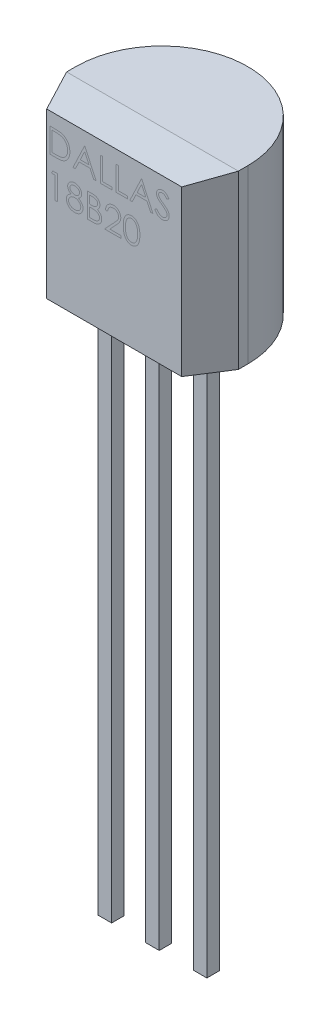
from build123d import *

# Parameters (mm, degrees)
BOSS_EXTRUDE1_DEPTH = 4.58
SKETCH4_W           = 0.36
SKETCH4_H           = 0.33
BOSS_EXTRUDE2_DEPTH = 14.47
SKETCH7_R           = 0.763333333
CUT_EXTRUDE1_DEPTH  = 0.25


with BuildPart() as part:
    # Sketch1 → Boss-Extrude1 (new body)
    with BuildSketch(Plane(origin=(0, 0, 0), x_dir=(1, 0, 0), z_dir=(0, 1, 0))):
        with BuildLine():
            Line((-2.29, 0), (-2.29, -0.25))
            Line((-2.29, -0.25), (2.29, -0.25))
            Line((2.29, -0.25), (2.29, 0))
            ThreePointArc((2.29, 0), (0, 2.29), (-2.29, 0))
        make_face()
    extrude(amount=BOSS_EXTRUDE1_DEPTH)

    # Sketch2 → Loft1 section 0
    with BuildSketch(Plane.XY.offset(0.25)):
        with BuildLine():
            Line((-2.29, 0), (2.29, 0))
            Line((2.29, 0), (2.29, 4.58))
            Line((2.29, 4.58), (-2.29, 4.58))
            Line((-2.29, 4.58), (-2.29, 0))
        make_face()
    # Sketch3 → Loft1 section 1
    with BuildSketch(Plane.XY.offset(1.27)):
        with BuildLine():
            Line((-1.8, 0.1), (1.8, 0.1))
            Line((1.8, 0.1), (1.8, 4.48))
            Line((1.8, 4.48), (-1.8, 4.48))
            Line((-1.8, 4.48), (-1.8, 0.1))
        make_face()
    loft()

    # Sketch4 → Boss-Extrude2 (add)
    with BuildSketch(Plane.XZ):
        with Locations((0, 0.085)):
            Rectangle(SKETCH4_W, SKETCH4_H)
        with Locations((-1.27, 0.085)):
            Rectangle(SKETCH4_W, SKETCH4_H)
        with Locations((1.27, 0.085)):
            Rectangle(SKETCH4_W, SKETCH4_H)
    extrude(amount=BOSS_EXTRUDE2_DEPTH)

    # Sketch7 → Cut-Extrude1 (cut)
    with BuildSketch(Plane.XY.offset(-2.29)):
        with Locations((0, 2.29)):
            Circle(SKETCH7_R)
    extrude(amount=CUT_EXTRUDE1_DEPTH, mode=Mode.SUBTRACT)


solid = part.part
